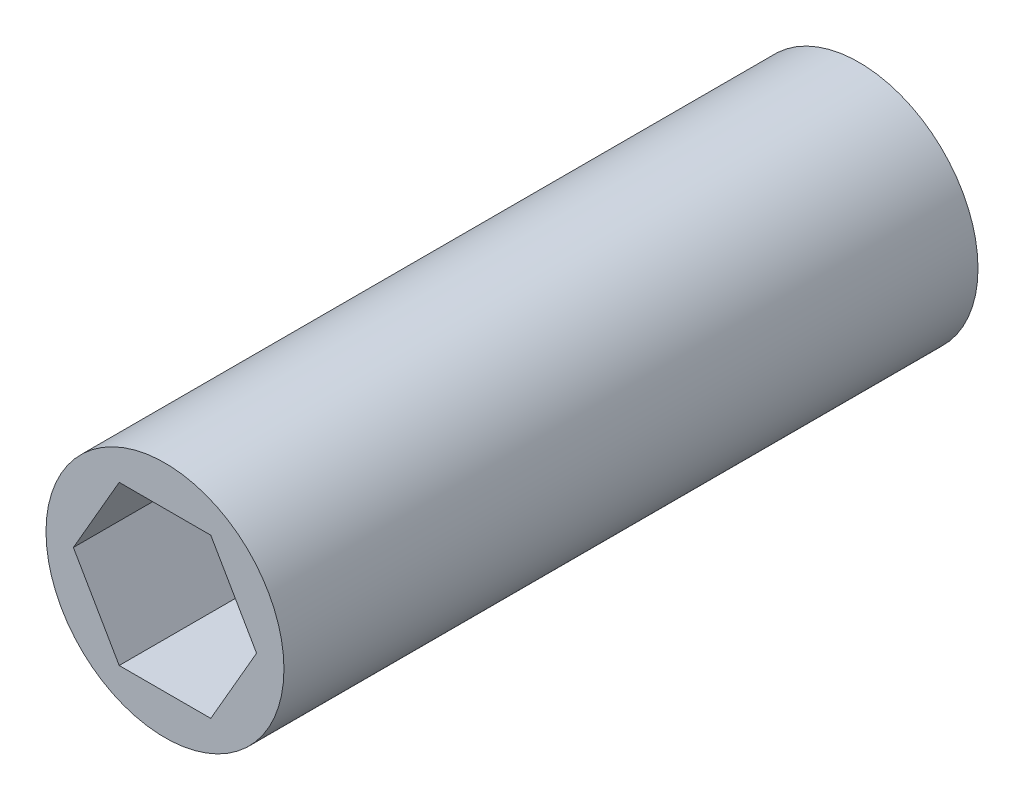
from build123d import *

# Parameters (mm, degrees)
SKETCH1_R           = 9.525
BOSS_EXTRUDE1_DEPTH = 27.78125


with BuildPart() as part:
    # Sketch1 → Boss-Extrude1 (new, symmetric)
    with BuildSketch(Plane.XY):
        Circle(SKETCH1_R)
        Polygon((7.332348419, 0), (3.666174209, 6.35), (-3.666174209, 6.35), (-7.332348419, 0), (-3.666174209, -6.35), (3.666174209, -6.35), align=None, mode=Mode.SUBTRACT)
    extrude(amount=BOSS_EXTRUDE1_DEPTH, both=True)


solid = part.part
